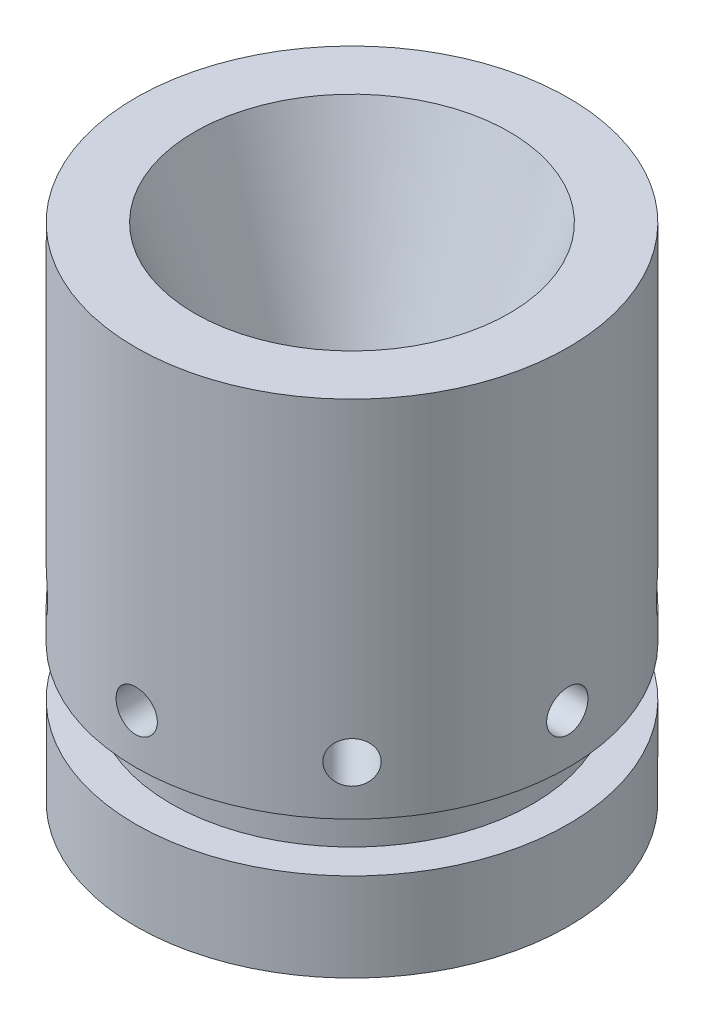
from build123d import *

# Parameters (mm, degrees)
SKETCH3_R          = 1.05
CUT_EXTRUDE1_DEPTH = 6
CIRPATTERN1_COUNT  = 8


with BuildPart() as part:
    # Sketch2 → Revolve1 (revolve)
    with BuildSketch(Plane.XY):
        Polygon((-2.5, 0), (-2.5, 2), (-8, 17), (-11, 17), (-11, 2), (-11, -1.5), (-9.2, -1.5), (-9.2, -4), (-11, -4), (-11, -8.5), align=None)
    revolve(axis=Axis((0, 19.141519074, 0), (0, -1, 0)))

    # Sketch3 → Cut-Extrude1 (cut)
    with BuildSketch(Plane.ZY.offset(11)):
        with Locations((0, 1)):
            Circle(SKETCH3_R)
    cut_extrude1 = extrude(amount=-CUT_EXTRUDE1_DEPTH, mode=Mode.SUBTRACT)

    # CirPattern1: Cut-Extrude1 ×8 about axis
    cirpattern1_axis = Axis((0, 0, 0), (0, 1, 0))
    for i in range(1, CIRPATTERN1_COUNT):
        add(cut_extrude1.rotate(cirpattern1_axis, i * 360 / CIRPATTERN1_COUNT), mode=Mode.SUBTRACT)


solid = part.part
